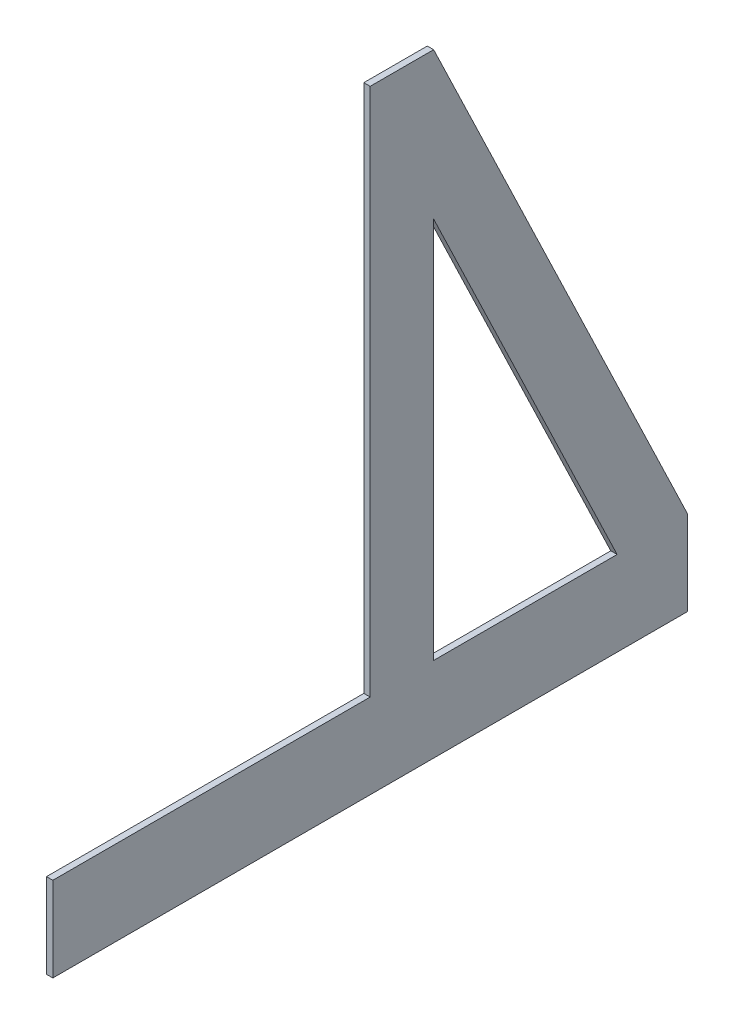
from build123d import *

# Parameters (mm, degrees)
EXTRUDE_541_DEPTH = 6


with BuildPart() as part:
    # Sketch 533 → Extrude 541 (new body)
    with BuildSketch(Plane(origin=(0, 0, 0), x_dir=(0, 0, -1), z_dir=(1, 0, 0))):
        Polygon((-593.846153846, -244.461538462), (6.153846154, -244.461538462), (6.153846154, -164.461538462), (-233.846153846, 335.538461538), (-293.846153846, 335.538461538), (-293.846153846, -164.461538462), (-593.846153846, -164.461538462), align=None)
        Polygon((-233.846153846, -164.461538462), (-60.400192041, -164.461538462), (-233.846153846, 196.8842153), align=None, mode=Mode.SUBTRACT)
    extrude(amount=EXTRUDE_541_DEPTH)


solid = part.part
